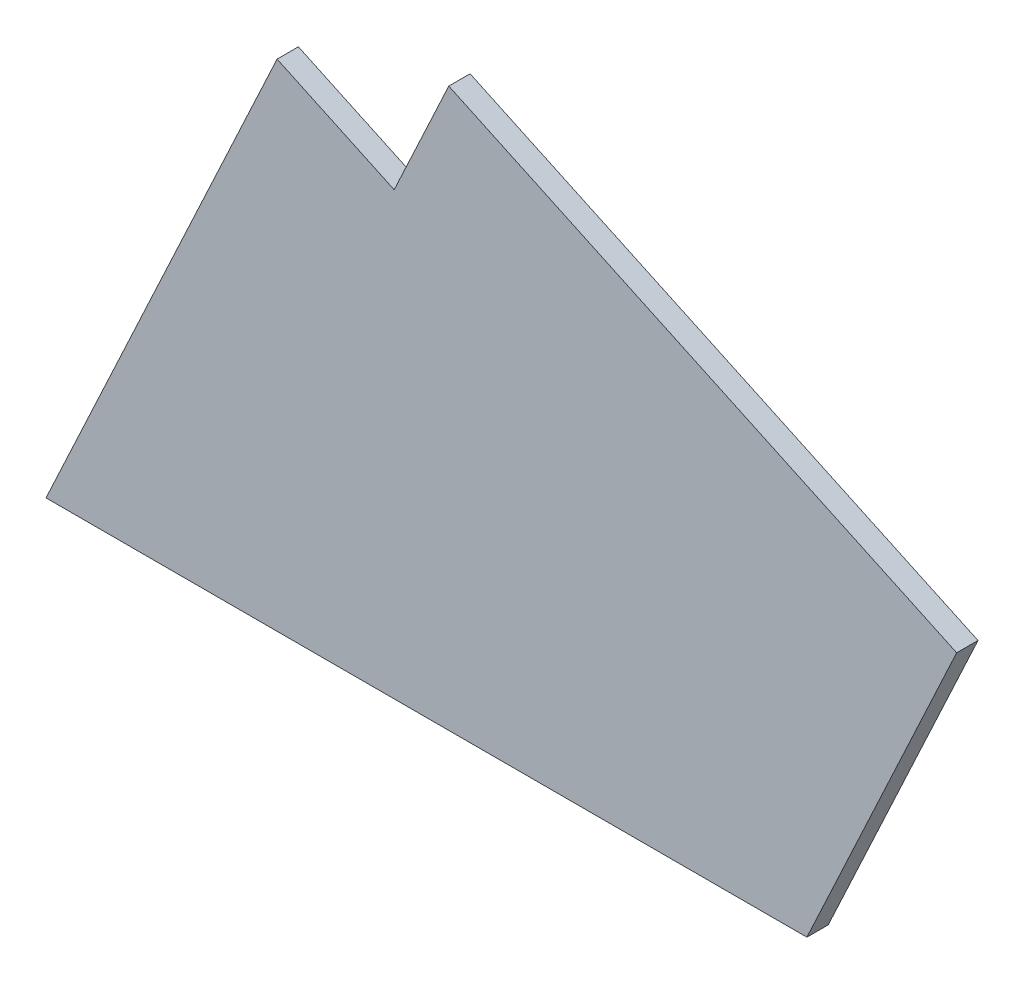
from build123d import *

# Parameters (mm, degrees)
BOSS_EXTRUDE1_DEPTH = 3.3


with BuildPart() as part:
    # Sketch1 → Boss-Extrude1 (new body)
    with BuildSketch(Plane.XY.offset(396.7)):
        Polygon((-321.546211223, 12.634626083), (-203.763939038, 12.634626083), (-180.579435925, 62.353953457), (-259.198908878, 99.014815774), (-267.651274112, 80.888660034), (-285.777429853, 89.341025269), align=None)
    extrude(amount=-BOSS_EXTRUDE1_DEPTH)


solid = part.part
